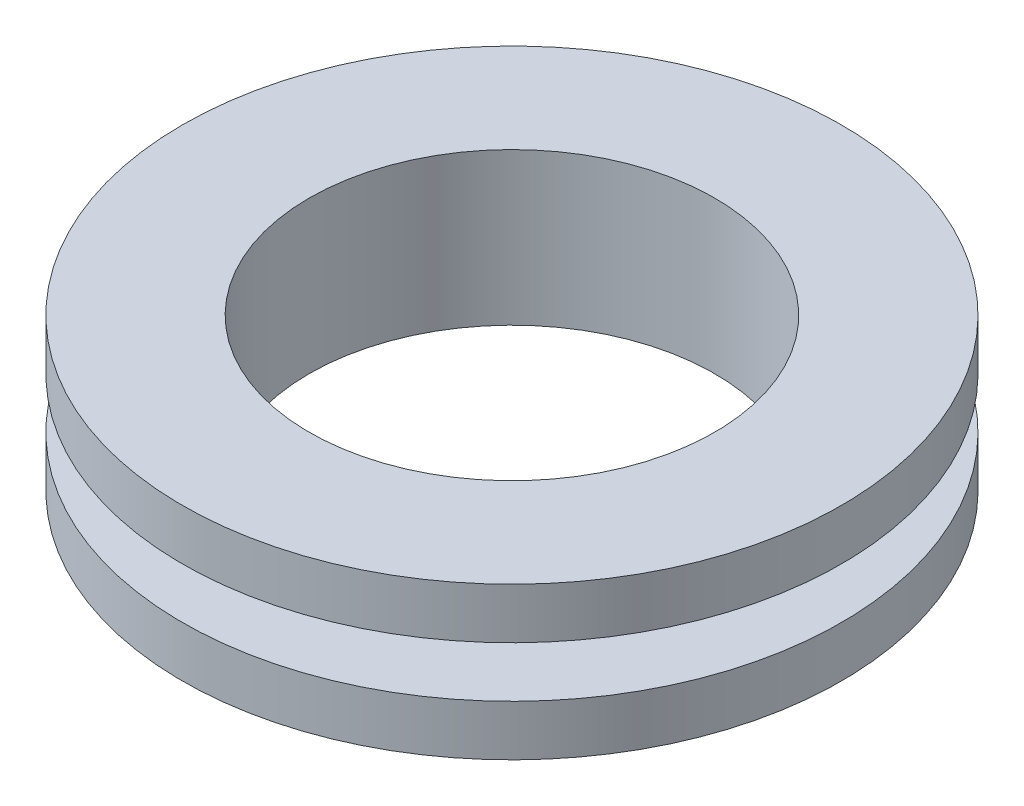
from build123d import *


with BuildPart() as part:
    # Sketch1 → Revolve1 (revolve)
    with BuildSketch(Plane.XY):
        Polygon((5, 0.5), (5, -0.5), (6.5, -0.5), (6.5, -1.5), (4, -1.5), (4, 1.5), (6.5, 1.5), (6.5, 0.5), align=None)
    revolve(axis=Axis((0, 3.800150025, 0), (0, -1, 0)))


solid = part.part
